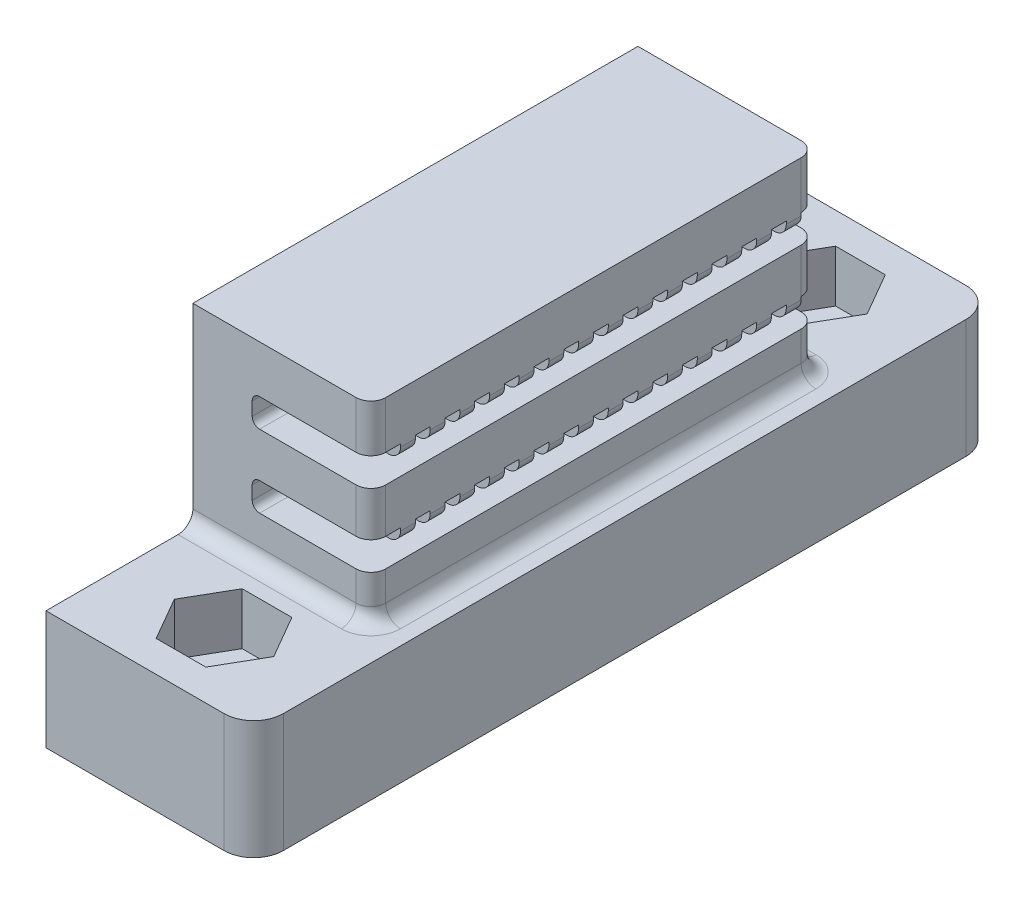
from build123d import *

# Parameters (mm, degrees)
CROQUIS1_W              = 14
CROQUIS1_H              = 50
CROQUIS1_R              = 1.55
SALIENTE_EXTRUIR1_DEPTH = 8
CORTAR_EXTRUIR1_DEPTH   = 3.5
CROQUIS3_W              = 14
CROQUIS3_H              = 30
SALIENTE_EXTRUIR3_DEPTH = 13
CORTAR_EXTRUIR2_DEPTH   = 10
CROQUIS5_W              = 30
CROQUIS5_H              = 13
CORTAR_EXTRUIR3_DEPTH   = 2
REDONDEO1_R             = 0.8
REDONDEO2_R             = 2
REDONDEO3_R             = 1
REDONDEO4_R             = 1
REDONDEO5_R             = 0.5


with BuildPart() as part:
    # Croquis1 → Saliente-Extruir1 (new body)
    with BuildSketch(Plane(origin=(0, 0, 0), x_dir=(1, 0, 0), z_dir=(0, 1, 0))):
        with Locations((7, 25)):
            Rectangle(CROQUIS1_W, CROQUIS1_H)
        with Locations((7, 45)):
            Circle(CROQUIS1_R, mode=Mode.SUBTRACT)
        with Locations((7, 5)):
            Circle(CROQUIS1_R, mode=Mode.SUBTRACT)
    extrude(amount=SALIENTE_EXTRUIR1_DEPTH)

    # Croquis2 → Cortar-Extruir1 (cut)
    with BuildSketch(Plane(origin=(0, 8, 0), x_dir=(1, 0, 0), z_dir=(0, 1, 0))):
        Polygon((10.348631561, 45), (8.674315781, 47.9), (5.325684219, 47.9), (3.651368439, 45), (5.325684219, 42.1), (8.674315781, 42.1), align=None)
        Polygon((10.348631561, 5), (8.674315781, 7.9), (5.325684219, 7.9), (3.651368439, 5), (5.325684219, 2.1), (8.674315781, 2.1), align=None)
    extrude(amount=-CORTAR_EXTRUIR1_DEPTH, mode=Mode.SUBTRACT)

    # Croquis3 → Saliente-Extruir3 (add)
    with BuildSketch(Plane(origin=(0, 8, 0), x_dir=(1, 0, 0), z_dir=(0, 1, 0))):
        with Locations((7, 24.9)):
            Rectangle(CROQUIS3_W, CROQUIS3_H)
    extrude(amount=SALIENTE_EXTRUIR3_DEPTH)

    # Croquis4 → Cortar-Extruir2 (cut)
    with BuildSketch(Plane(origin=(14, 0, 0), x_dir=(0, 0, -1), z_dir=(1, 0, 0))):
        Polygon((39.9, 17.8), (38.9, 17.8), (38.9, 16.8), (37.9, 16.8), (37.9, 17.8), (36.9, 17.8), (36.9, 16.8), (35.9, 16.8), (35.9, 17.8), (34.9, 17.8), (34.9, 16.8), (33.9, 16.8), (33.9, 17.8), (32.9, 17.8), (32.9, 16.8), (31.9, 16.8), (31.9, 17.8), (30.9, 17.8), (30.9, 16.8), (29.9, 16.8), (29.9, 17.8), (28.9, 17.8), (28.9, 16.8), (27.9, 16.8), (27.9, 17.8), (26.9, 17.8), (26.9, 16.8), (25.9, 16.8), (25.9, 17.8), (24.9, 17.8), (24.9, 16.8), (23.9, 16.8), (23.9, 17.8), (22.9, 17.8), (22.9, 16.8), (21.9, 16.8), (21.9, 17.8), (20.9, 17.8), (20.9, 16.8), (19.9, 16.8), (19.9, 17.8), (18.9, 17.8), (18.9, 16.8), (17.9, 16.8), (17.9, 17.8), (16.9, 17.8), (16.9, 16.8), (15.9, 16.8), (15.9, 17.8), (14.9, 17.8), (14.9, 16.8), (13.9, 16.8), (13.9, 17.8), (12.9, 17.8), (12.9, 16.8), (11.9, 16.8), (11.9, 17.8), (9.9, 17.8), (9.9, 15.9), (39.9, 15.9), align=None)
        Polygon((39.9, 12.9), (38.9, 12.9), (38.9, 11.9), (37.9, 11.9), (37.9, 12.9), (36.9, 12.9), (36.9, 11.9), (35.9, 11.9), (35.9, 12.9), (34.9, 12.9), (34.9, 11.9), (33.9, 11.9), (33.9, 12.9), (32.9, 12.9), (32.9, 11.9), (31.9, 11.9), (31.9, 12.9), (30.9, 12.9), (30.9, 11.9), (29.9, 11.9), (29.9, 12.9), (28.9, 12.9), (28.9, 11.9), (27.9, 11.9), (27.9, 12.9), (26.9, 12.9), (26.9, 11.9), (25.9, 11.9), (25.9, 12.9), (24.9, 12.9), (24.9, 11.9), (23.9, 11.9), (23.9, 12.9), (22.9, 12.9), (22.9, 11.9), (21.9, 11.9), (21.9, 12.9), (20.9, 12.9), (20.9, 11.9), (19.9, 11.9), (19.9, 12.9), (18.9, 12.9), (18.9, 11.9), (17.9, 11.9), (17.9, 12.9), (16.9, 12.9), (16.9, 11.9), (15.9, 11.9), (15.9, 12.9), (14.9, 12.9), (14.9, 11.9), (13.9, 11.9), (13.9, 12.9), (12.9, 12.9), (12.9, 11.9), (11.9, 11.9), (11.9, 12.9), (9.9, 12.9), (9.9, 11), (39.9, 11), align=None)
    extrude(amount=-CORTAR_EXTRUIR2_DEPTH, mode=Mode.SUBTRACT)

    # Croquis5 → Cortar-Extruir3 (cut)
    with BuildSketch(Plane(origin=(14, 0, 0), x_dir=(0, 0, -1), z_dir=(1, 0, 0))):
        with Locations((24.9, 14.5)):
            Rectangle(CROQUIS5_W, CROQUIS5_H)
    extrude(amount=-CORTAR_EXTRUIR3_DEPTH, mode=Mode.SUBTRACT)

    # Redondeo1
    redondeo1_edges = [part.edges().sort_by_distance(p)[0] for p in [
        (12, 11.9, -12.4),
        (12, 11.9, -14.4),
        (12, 11.9, -16.4),
        (12, 11.9, -18.4),
        (12, 11.9, -20.4),
        (12, 11.9, -22.4),
        (12, 11.9, -24.4),
        (12, 11.9, -26.4),
        (12, 11.9, -28.4),
        (12, 11.9, -30.4),
        (12, 11.9, -32.4),
        (12, 11.9, -34.4),
        (12, 11.9, -36.4),
        (12, 11.9, -38.4),
        (12, 16.8, -38.4),
        (12, 16.8, -36.4),
        (12, 16.8, -34.4),
        (12, 16.8, -32.4),
        (12, 16.8, -30.4),
        (12, 16.8, -28.4),
        (12, 16.8, -26.4),
        (12, 16.8, -24.4),
        (12, 16.8, -22.4),
        (12, 16.8, -20.4),
        (12, 16.8, -18.4),
        (12, 16.8, -16.4),
        (12, 16.8, -14.4),
        (12, 16.8, -12.4),
    ]]
    fillet(redondeo1_edges, radius=REDONDEO1_R)

    # Redondeo2
    redondeo2_edges = [part.edges().sort_by_distance(p)[0] for p in [
        (14, 4, -50),
        (14, 4, 0),
    ]]
    fillet(redondeo2_edges, radius=REDONDEO2_R)

    # Redondeo3
    redondeo3_edges = [part.edges().sort_by_distance(p)[0] for p in [
        (12, 19.4, -39.9),
        (12, 14.4, -39.9),
        (12, 9.5, -39.9),
        (12, 9.5, -9.9),
        (12, 14.4, -9.9),
        (12, 19.4, -9.9),
    ]]
    fillet(redondeo3_edges, radius=REDONDEO3_R)

    # Redondeo4
    redondeo4_edges = [part.edges().sort_by_distance(p)[0] for p in [
        (5.5, 8, -9.9),
        (11.707106781, 8, -10.192893219),
        (12, 8, -24.9),
        (11.707106781, 8, -39.607106781),
        (5.5, 8, -39.9),
    ]]
    fillet(redondeo4_edges, radius=REDONDEO4_R)

    # Redondeo5
    redondeo5_edges = [part.edges().sort_by_distance(p)[0] for p in [
        (4, 12.9, -10.9),
        (4, 12.9, -13.4),
        (4, 12.9, -15.4),
        (4, 12.9, -17.4),
        (4, 12.9, -19.4),
        (4, 12.9, -21.4),
        (4, 12.9, -25.4),
        (4, 12.9, -23.4),
        (4, 12.9, -27.4),
        (4, 12.9, -29.4),
        (4, 12.9, -31.4),
        (4, 12.9, -33.4),
        (4, 12.9, -35.4),
        (4, 12.9, -37.4),
        (4, 12.9, -39.4),
        (4, 17.8, -39.4),
        (4, 17.8, -37.4),
        (4, 17.8, -35.4),
        (4, 17.8, -33.4),
        (4, 17.8, -31.4),
        (4, 17.8, -29.4),
        (4, 17.8, -27.4),
        (4, 17.8, -25.4),
        (4, 17.8, -23.4),
        (4, 17.8, -21.4),
        (4, 17.8, -19.4),
        (4, 17.8, -17.4),
        (4, 17.8, -15.4),
        (4, 17.8, -13.4),
        (4, 17.8, -10.9),
        (4, 15.9, -24.9),
        (4, 11, -24.9),
    ]]
    fillet(redondeo5_edges, radius=REDONDEO5_R)


solid = part.part
